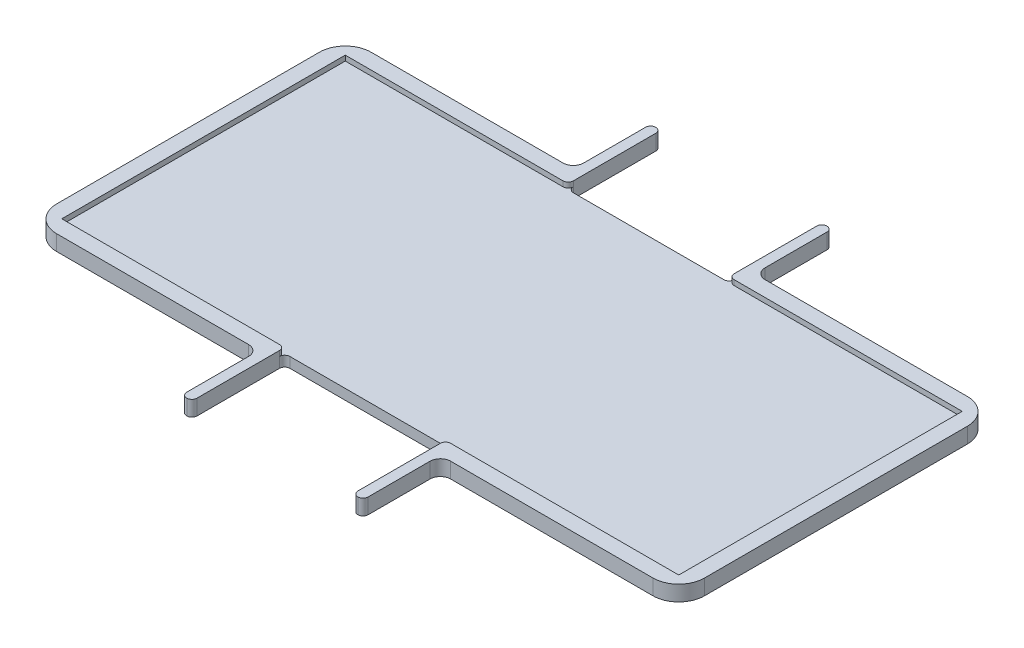
from build123d import *

# Parameters (mm, degrees)
BOSS_EXTRUDE3_DEPTH   = 3
BOSS_EXTRUDE3_2_DEPTH = 3
SKETCH2_W             = 119.7
SKETCH2_H             = 55
BOSS_EXTRUDE4_DEPTH   = 2
FILLET5_R             = 2
FILLET6_R             = 5
FILLET7_R             = 1
FILLET8_R             = 1
FILLET9_R             = 1


with BuildPart() as part:
    # Sketch1 → Boss-Extrude3 (new body)
    with BuildSketch(Plane(origin=(0, 0, 0), x_dir=(1, 0, 0), z_dir=(0, 1, 0))):
        Polygon((119.7, 0), (74.45, 0), (74.45, -3), (74.45, -18), (76.45, -18), (76.45, -3), (122.7, -3), (122.7, 58), (76.45, 58), (76.45, 73), (74.45, 73), (74.45, 58), (74.45, 55), (119.7, 55), align=None)
    extrude(amount=BOSS_EXTRUDE3_DEPTH)



with BuildPart() as body_2:
    # Sketch1 → Boss-Extrude3 2 (new body)
    with BuildSketch(Plane(origin=(0, 0, 0), x_dir=(1, 0, 0), z_dir=(0, 1, 0))):
        Polygon((-3, 58), (-3, -3), (41.25, -3), (41.25, -18), (43.25, -18), (43.25, -3), (43.25, 0), (0, 0), (0, 55), (43.25, 55), (43.25, 58), (43.25, 73), (41.25, 73), (41.25, 58), align=None)
    extrude(amount=BOSS_EXTRUDE3_2_DEPTH)


with BuildPart() as part_1:
    add(part.part)

    add(body_2.part)  # Boss-Extrude4 merges body 2
    # Sketch2 → Boss-Extrude4 (add)
    with BuildSketch(Plane(origin=(0, 0, 0), x_dir=(1, 0, 0), z_dir=(0, 1, 0))):
        with Locations((59.85, 27.5)):
            Rectangle(SKETCH2_W, SKETCH2_H)
    extrude(amount=BOSS_EXTRUDE4_DEPTH)

    # Fillet5
    fillet5_edges = [part_1.edges().sort_by_distance(p)[0] for p in [
        (76.45, 1.5, -58),
        (76.45, 1.5, 3),
        (41.25, 1.5, -58),
        (41.25, 1.5, 3),
    ]]
    fillet(fillet5_edges, radius=FILLET5_R)

    # Fillet6
    fillet6_edges = [part_1.edges().sort_by_distance(p)[0] for p in [
        (122.7, 1.5, -58),
        (122.7, 1.5, 3),
        (-3, 1.5, -58),
        (-3, 1.5, 3),
    ]]
    fillet(fillet6_edges, radius=FILLET6_R)

    # Fillet7
    fillet7_edges = [part_1.edges().sort_by_distance(p)[0] for p in [
        (74.45, 1.5, 18),
        (76.45, 1.5, 18),
        (43.25, 1.5, 18),
        (41.25, 1.5, 18),
        (41.25, 1.5, -73),
        (43.25, 1.5, -73),
        (74.45, 1.5, -73),
        (76.45, 1.5, -73),
    ]]
    fillet(fillet7_edges, radius=FILLET7_R - 0.0001)  # a hair under: the kernel refuses the full size

    # Fillet8
    fillet8_edges = [part_1.edges().sort_by_distance(p)[0] for p in [
        (74.45, 2.5, -55),
        (74.45, 2.5, 0),
        (43.25, 2.5, 0),
        (43.25, 2.5, -55),
    ]]
    fillet(fillet8_edges, radius=FILLET8_R)

    # Fillet9
    fillet9_edges = [part_1.edges().sort_by_distance(p)[0] for p in [
        (43.25, 1, -55),
        (74.45, 1, -55),
        (74.45, 1, 0),
        (43.25, 1, 0),
    ]]
    fillet(fillet9_edges, radius=FILLET9_R)


solid = part_1.part
